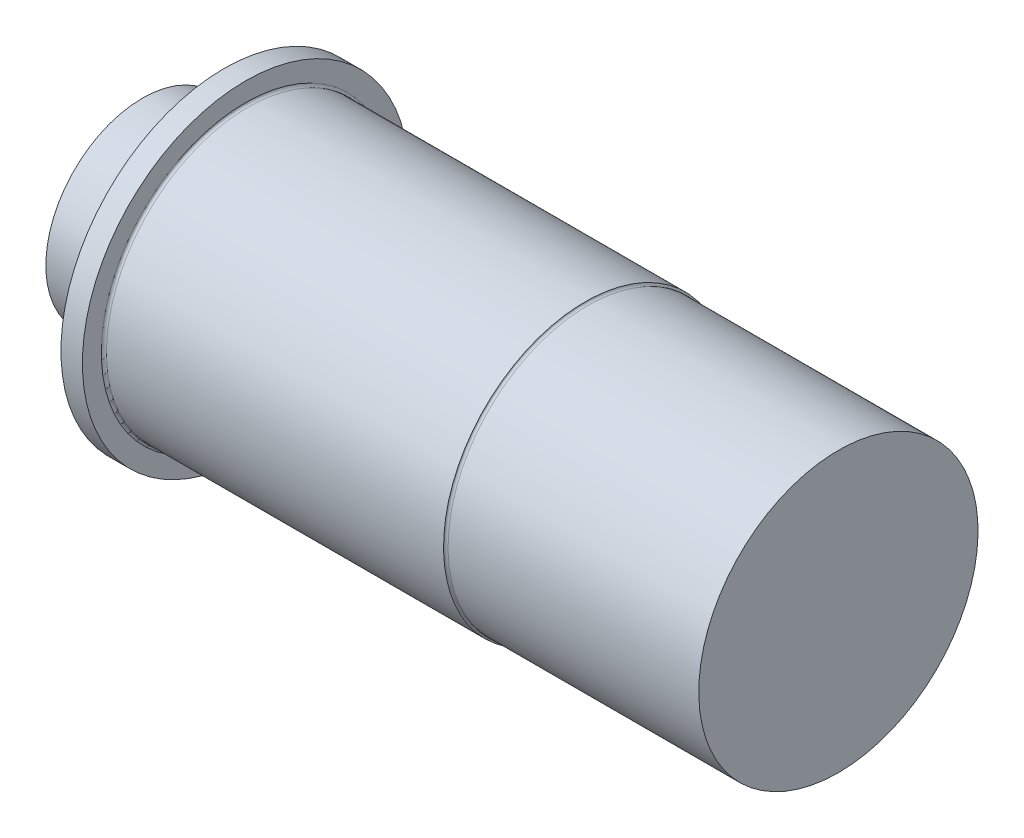
from build123d import *

# Parameters (mm, degrees)
FILLET1_R = 0.6


with BuildPart() as part:
    # Sketch1 → Revolve1 (revolve)
    with BuildSketch(Plane.XY, mode=Mode.PRIVATE) as revolve1_sk:
        Polygon((-81.066688046, 0), (81.066688046, 0), (81.066688046, 32.5325), (40.066688046, 32.5325), (22.066688046, 32.5325), (22.066688046, 33), (-15.469523763, 33), (-57.066688046, 33), (-57.066688046, 38), (-62.066688046, 38), (-62.066688046, 22.5225), (-81.066688046, 22.5225), align=None)
    revolve(revolve1_sk.sketch.rotate(Axis((-122.765721942, 0, 0), (1, 0, 0)), 180), axis=Axis((-122.765721942, 0, 0), (1, 0, 0)))

    # Fillet1
    # the kernel refuses this fillet: 0.6 mm, written as the material it adds along each edge
    with BuildSketch(Plane(origin=(22.066688046, 0, 0), x_dir=(0, -1, 0), z_dir=(0, 0, 1))) as fillet1_piece_1:
        with BuildLine():
            CenterArc((33.1325, 0.585186936), FILLET1_R, 180, 77.242016626)
            Line((33, 0), (32.99735, -0.011703739))
            ThreePointArc((32.99735, -0.011703739), (32.76625, -0.012), (32.5325, -0.012))
            Line((32.5325, -0.012), (32.5205, 0))
            Line((32.5205, 0), (32.5205, 0.585186936))
            Line((32.5205, 0.585186936), (32.5325, 0.585186936))
        make_face()
    revolve(axis=Axis((22.066688046, 0, 0), (1, 0, 0)))
    with BuildSketch(Plane(origin=(-57.066688046, 0, 0), x_dir=(0, -1, 0), z_dir=(0, 0, 1))) as fillet1_piece_2:
        with BuildLine():
            CenterArc((33 + FILLET1_R, FILLET1_R), FILLET1_R, 180, 90)
            Line((33 + FILLET1_R, 0), (33 + FILLET1_R, -FILLET1_R * 0.02))
            Line((33 + FILLET1_R, -FILLET1_R * 0.02), (33 - FILLET1_R * 0.02, -FILLET1_R * 0.02))
            Line((33 - FILLET1_R * 0.02, -FILLET1_R * 0.02), (33 - FILLET1_R * 0.02, FILLET1_R))
            Line((33 - FILLET1_R * 0.02, FILLET1_R), (33, FILLET1_R))
        make_face()
    revolve(axis=Axis((-57.066688046, 0, 0), (1, 0, 0)))
    with BuildSketch(Plane(origin=(-62.066688046, 0, 0), x_dir=(0, -1, 0), z_dir=(0, 0, 1))) as fillet1_piece_3:
        with BuildLine():
            CenterArc((22.5225 + FILLET1_R, -FILLET1_R), FILLET1_R, 90, 90)
            Line((22.5225, -FILLET1_R), (22.5225 - FILLET1_R * 0.02, -FILLET1_R))
            Line((22.5225 - FILLET1_R * 0.02, -FILLET1_R), (22.5225 - FILLET1_R * 0.02, FILLET1_R * 0.02))
            Line((22.5225 - FILLET1_R * 0.02, FILLET1_R * 0.02), (22.5225 + FILLET1_R, FILLET1_R * 0.02))
            Line((22.5225 + FILLET1_R, FILLET1_R * 0.02), (22.5225 + FILLET1_R, 0))
        make_face()
    revolve(axis=Axis((-62.066688046, 0, 0), (1, 0, 0)))


solid = part.part
